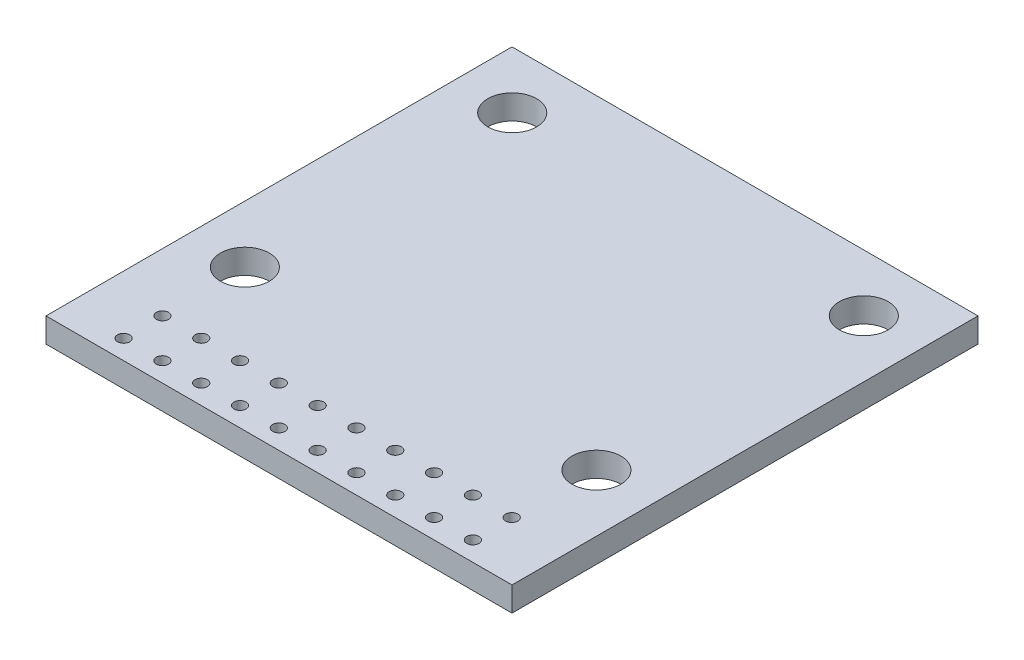
from build123d import *

# Parameters (mm, degrees)
CROQUIS1_W              = 30.5
CROQUIS1_H              = 30.5
SALIENTE_EXTRUIR1_DEPTH = 1.6
CROQUIS2_R              = 1.6
CORTAR_EXTRUIR3_DEPTH   = 22.626025987
CROQUIS3_R              = 0.4
CORTAR_EXTRUIR4_DEPTH   = 22.626025987


with BuildPart() as part:
    # Croquis1 → Saliente-Extruir1 (new body)
    with BuildSketch(Plane(origin=(0, 0, 0), x_dir=(1, 0, 0), z_dir=(0, 1, 0))):
        Rectangle(CROQUIS1_W, CROQUIS1_H)
    extrude(amount=SALIENTE_EXTRUIR1_DEPTH)

    # Croquis2 → Cortar-Extruir3 (cut, through all)
    with BuildSketch(Plane(origin=(0, 1.6, 0), x_dir=(1, 0, 0), z_dir=(0, 1, 0))):
        with Locations((-11.505, 11.52)):
            Circle(CROQUIS2_R)
        with Locations((11.505, 11.52)):
            Circle(CROQUIS2_R)
        with Locations((11.505, -5.98)):
            Circle(CROQUIS2_R)
        with Locations((-11.505, -5.98)):
            Circle(CROQUIS2_R)
    extrude(amount=-CORTAR_EXTRUIR3_DEPTH, mode=Mode.SUBTRACT)

    # Croquis3 → Cortar-Extruir4 (cut, through all)
    with BuildSketch(Plane(origin=(0, 1.6, 0), x_dir=(1, 0, 0), z_dir=(0, 1, 0))):
        with Locations((-11.44, -13.98)):
            Circle(CROQUIS3_R)
        with Locations((-8.9, -13.98)):
            Circle(CROQUIS3_R)
        with Locations((-6.36, -13.98)):
            Circle(CROQUIS3_R)
        with Locations((-3.82, -13.98)):
            Circle(CROQUIS3_R)
        with Locations((-1.28, -13.98)):
            Circle(CROQUIS3_R)
        with Locations((1.26, -13.98)):
            Circle(CROQUIS3_R)
        with Locations((3.8, -13.98)):
            Circle(CROQUIS3_R)
        with Locations((6.34, -13.98)):
            Circle(CROQUIS3_R)
        with Locations((8.88, -13.98)):
            Circle(CROQUIS3_R)
        with Locations((11.42, -13.98)):
            Circle(CROQUIS3_R)
        with Locations((-11.44, -11.44)):
            Circle(CROQUIS3_R)
        with Locations((-8.9, -11.44)):
            Circle(CROQUIS3_R)
        with Locations((-6.36, -11.44)):
            Circle(CROQUIS3_R)
        with Locations((-3.82, -11.44)):
            Circle(CROQUIS3_R)
        with Locations((-1.28, -11.44)):
            Circle(CROQUIS3_R)
        with Locations((1.26, -11.44)):
            Circle(CROQUIS3_R)
        with Locations((3.8, -11.44)):
            Circle(CROQUIS3_R)
        with Locations((6.34, -11.44)):
            Circle(CROQUIS3_R)
        with Locations((8.88, -11.44)):
            Circle(CROQUIS3_R)
        with Locations((11.42, -11.44)):
            Circle(CROQUIS3_R)
    extrude(amount=-CORTAR_EXTRUIR4_DEPTH, mode=Mode.SUBTRACT)


solid = part.part
